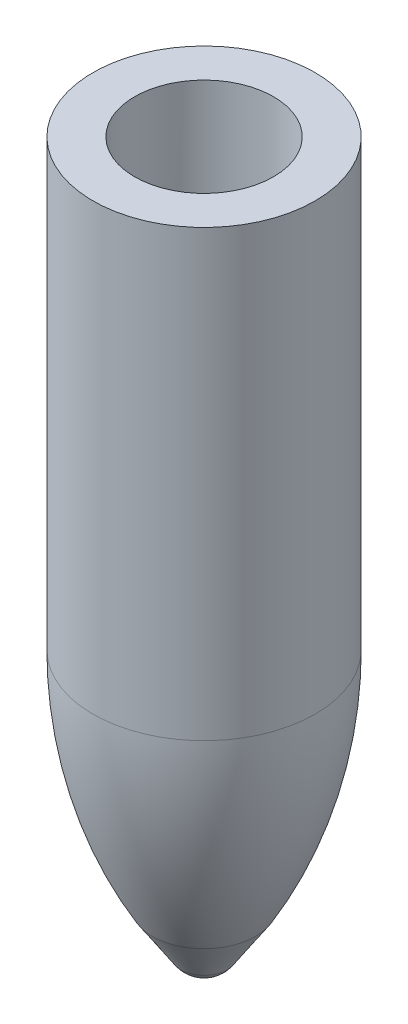
from build123d import *

# Parameters (mm, degrees)
CUT_EXTRUDE1_DEPTH      = 90.050468029
CUT_EXTRUDE1_DEPTH_BACK = 90.050468029
SKETCH3_W               = 27.181091561
SKETCH3_H               = 38.454465552


# Read off the part's stored shape, not the designer's step: Shell2
with BuildPart() as part:
    # Sketch1 → Revolve1 (revolve)
    with BuildSketch(Plane.XY, mode=Mode.PRIVATE) as revolve1_sk:
        with BuildLine():
            Line((0, 0), (0, -50.8))
            ThreePointArc((0, -50.8), (3.280951188, -68.760512242), (12.7, -84.401041651))
            Line((12.7, -84.401041651), (12.7, 0))
            Line((12.7, 0), (0, 0))
        make_face()
    revolve(revolve1_sk.sketch.rotate(Axis((12.7, -84.401041651, 0), (0, 1, 0)), 180), axis=Axis((12.7, -84.401041651, 0), (0, 1, 0)))

    # Shell2 outline → Shell2 (revolve, cut)
    with BuildSketch(Plane(origin=(12.7, 0, 0), x_dir=(1, 0, 0), z_dir=(0, 0, 1))):
        with BuildLine():
            Line((0, 0), (0, -76.642627696))
            add(Edge.make_bspline(
                [(7.9375, -50.8), (7.9375, -64.940305721), (0, -76.642627696)],
                knots=[0, 0, 0, 0.596002439, 0.596002439, 0.596002439], degree=2, weights=[1, 0.95592526, 1]))
            Line((7.9375, -50.8), (7.9375, 0))
            Line((7.9375, 0), (0, 0))
        make_face()
    revolve(axis=Axis((12.7, 0, 0), (0, 1, 0)), mode=Mode.SUBTRACT)

    # Sketch3 → Cut-Extrude1 (cut, two sides: drawn at the far end of the back side and taken through both)
    with BuildSketch(Plane.XY.offset(-CUT_EXTRUDE1_DEPTH_BACK)):
        with Locations((13.590545781, -70.027232776)):
            Rectangle(SKETCH3_W, SKETCH3_H)
    extrude(amount=CUT_EXTRUDE1_DEPTH + CUT_EXTRUDE1_DEPTH_BACK, mode=Mode.SUBTRACT)

    # Sketch2 → Revolve3 (revolve)
    with BuildSketch(Plane.XY, mode=Mode.PRIVATE) as revolve3_sk:
        with BuildLine():
            Line((12.7, -82.559521115), (12.7, -50.8))
            Line((12.7, -50.8), (0, -50.8))
            ThreePointArc((0, -50.8), (1.730968025, -63.948007491), (6.805909488, -76.2))
            Line((6.805909488, -76.2), (10.047183612, -81.128995309))
            ThreePointArc((10.047183612, -81.128995309), (11.193029623, -82.179098952), (12.7, -82.559521115))
        make_face()
    revolve(revolve3_sk.sketch.rotate(Axis((12.7, -82.559521115, 0), (0, 1, 0)), 180), axis=Axis((12.7, -82.559521115, 0), (0, 1, 0)))


solid = part.part
